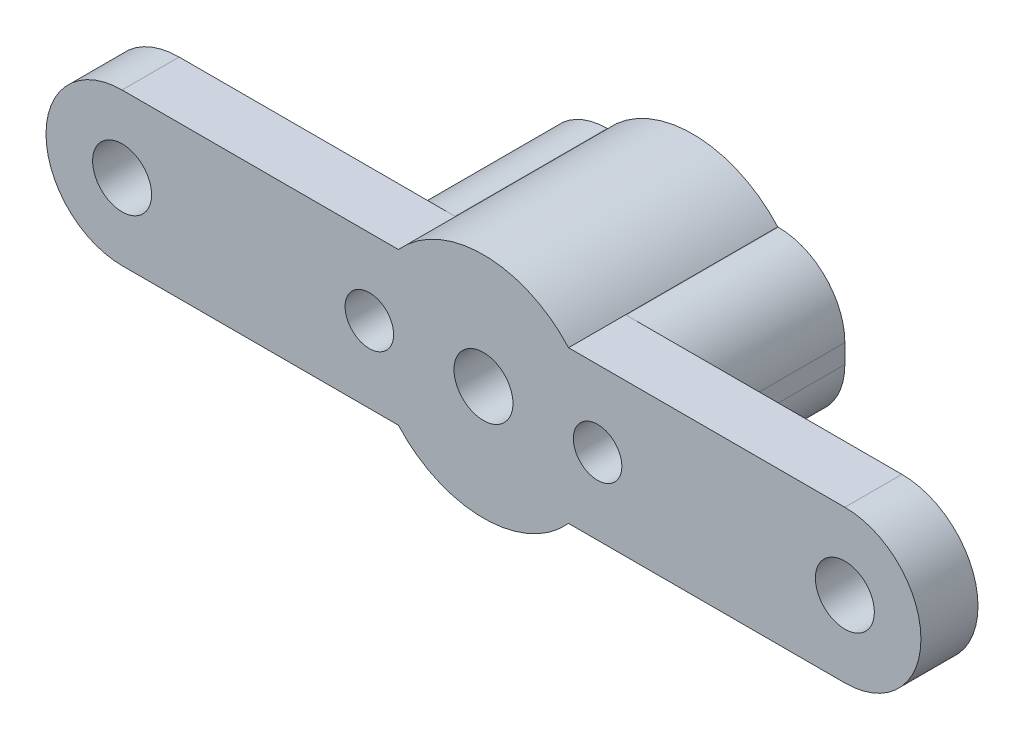
from build123d import *
from build123d.topology import SkipClean

# Parameters (mm, degrees)
SKETCH_1_R      = 1.55
SKETCH_1_R_2    = 1.275
EXTRUDE_1_DEPTH = 3
EXTRUDE_START   = 8
SKETCH_2_R      = 1.55
SKETCH_2_R_2    = 1.275
EXTRUDE_2_DEPTH = 8
FILLET_1_R      = 3.5


with BuildPart() as part:
    # 草图1 → 凸台-拉伸1 (new body)
    with BuildSketch(Plane.XY):
        with BuildLine():
            Line((4.472135955, 4), (19, 4))
            ThreePointArc((19, 4), (23, 0), (19, -4))
            Line((19, -4), (4.472135955, -4))
            ThreePointArc((4.472135955, -4), (0, -6), (-4.472135955, -4))
            Line((-4.472135955, -4), (-19, -4))
            ThreePointArc((-19, -4), (-23, 0), (-19, 4))
            Line((-19, 4), (-4.472135955, 4))
            ThreePointArc((-4.472135955, 4), (0, 6), (4.472135955, 4))
        make_face()
        Circle(SKETCH_1_R, mode=Mode.SUBTRACT)
        with Locations((19, 0)):
            Circle(SKETCH_1_R, mode=Mode.SUBTRACT)
        with Locations((-19, 0)):
            Circle(SKETCH_1_R, mode=Mode.SUBTRACT)
        with Locations((-6, 0)):
            Circle(SKETCH_1_R_2, mode=Mode.SUBTRACT)
        with Locations((6, 0)):
            Circle(SKETCH_1_R_2, mode=Mode.SUBTRACT)
    extrude(amount=EXTRUDE_1_DEPTH)

    # 草图2 → 凸台-拉伸2 (add)
    with SkipClean():  # the faces are left unmerged after this step: merging them gives an invalid solid
        with BuildSketch(Plane(origin=(0, 0, 0), x_dir=(-1, 0, 0), z_dir=(0, 0, -1)).offset(EXTRUDE_START)):
            with BuildLine():
                Line((-8, 4), (-4.472135955, 4))
                ThreePointArc((-4.472135955, 4), (0, 6), (4.472135955, 4))
                Line((4.472135955, 4), (8, 4))
                Line((8, 4), (8, -4))
                Line((8, -4), (4.472135955, -4))
                ThreePointArc((4.472135955, -4), (0, -6), (-4.472135955, -4))
                Line((-4.472135955, -4), (-8, -4))
                Line((-8, -4), (-8, 4))
            make_face()
            Circle(SKETCH_2_R, mode=Mode.SUBTRACT)
            with Locations((-6, 0)):
                Circle(SKETCH_2_R_2, mode=Mode.SUBTRACT)
            with Locations((6, 0)):
                Circle(SKETCH_2_R_2, mode=Mode.SUBTRACT)
        extrude(amount=-EXTRUDE_2_DEPTH)

    # 圆角1
    # the kernel refuses this fillet: 3.5 mm, written as the material it takes off along each edge
    with BuildSketch(Plane(origin=(8, -4, -16.75), x_dir=(0, 1, 0), z_dir=(0, 0, 1)), Plane(origin=(8, 4, -16.75), x_dir=(-1, 0, 0), z_dir=(0, 0, 1))) as fillet_1_piece_1:
        with BuildLine():
            CenterArc((FILLET_1_R, FILLET_1_R), FILLET_1_R, 180, 90)
            Line((0, FILLET_1_R), (0, 0))
            Line((0, 0), (FILLET_1_R, 0))
        make_face()
    extrude(amount=16.75, mode=Mode.SUBTRACT)
    with BuildSketch(Plane(origin=(-8, 4, -16.75), x_dir=(1, 0, 0), z_dir=(0, 0, 1)), Plane(origin=(-8, -4, -16.75), x_dir=(0, 1, 0), z_dir=(0, 0, 1))) as fillet_1_piece_2:
        with BuildLine():
            CenterArc((FILLET_1_R, -FILLET_1_R), FILLET_1_R, 90, 90)
            Line((0, -FILLET_1_R), (0, 0))
            Line((0, 0), (FILLET_1_R, 0))
        make_face()
    extrude(amount=16.75, mode=Mode.SUBTRACT)


solid = part.part
